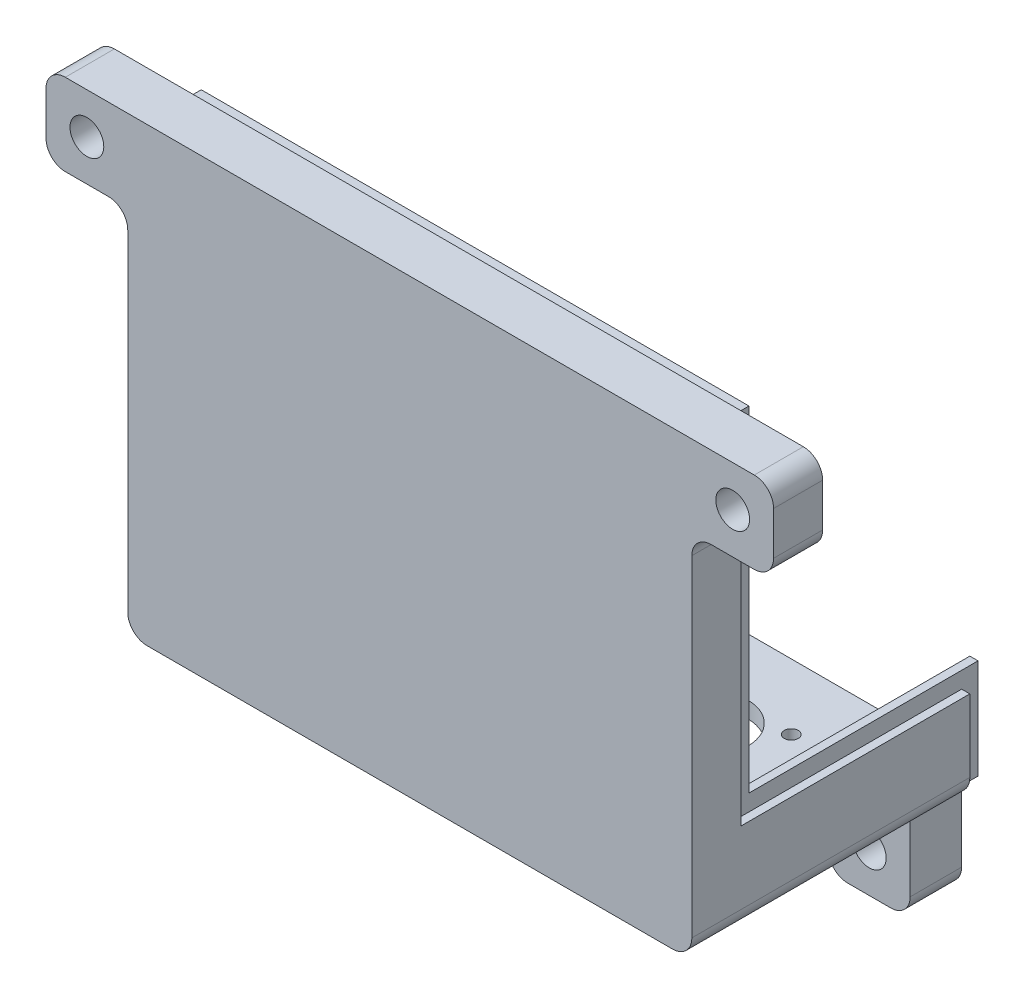
from build123d import *

# Parameters (mm, degrees)
SKETCH1_W           = 82.539998569
SKETCH1_H           = 65.04
BOSS_EXTRUDE1_DEPTH = 43.18
SHELL1_T            = 2.54
SKETCH2_R           = 1.085
CUT_EXTRUDE1_DEPTH  = 124.952130409
FILLET1_R           = 6.20014
FILLET2_R           = 1
SKETCH6_W           = 35.56
SKETCH6_H           = 50.8
CUT_EXTRUDE2_DEPTH  = 124.028758627
SKETCH3_R           = 2.125
BOSS_EXTRUDE2_DEPTH = 9.39038
CUT_EXTRUDE3_DEPTH  = 2.54
SKETCH8_W           = 1.27
SKETCH8_H           = 33.02
CUT_EXTRUDE4_DEPTH  = 2.54
SKETCH10_W          = 87.619998569
SKETCH10_H          = 10.145268184
BOSS_EXTRUDE3_DEPTH = 2.54
CUT_EXTRUDE5_DEPTH  = 2.54
SKETCH11_W          = 12.7
SKETCH11_H          = 8
BOSS_EXTRUDE4_DEPTH = 12.7
SKETCH12_R          = 2.625
CUT_EXTRUDE6_DEPTH  = 127.362400741
SKETCH13_W          = 7.62
SKETCH13_H          = 12.7
BOSS_EXTRUDE5_DEPTH = 12.7
SKETCH14_R          = 2.625
CUT_EXTRUDE7_DEPTH  = 125.717897357
FILLET3_R           = 3


with BuildPart() as part:
    # Sketch1 → Boss-Extrude1 (new body)
    with BuildSketch(Plane.XY):
        with Locations((47.599999189, 40.75)):
            Rectangle(SKETCH1_W, SKETCH1_H)
    extrude(amount=BOSS_EXTRUDE1_DEPTH)

    # Shell1
    shell1_openings = [part.faces().sort_by_distance(p)[0] for p in [
        (47.599999189, 73.27, 21.59),
        (47.599999189, 40.75, 0),
    ]]
    offset(amount=SHELL1_T, openings=shell1_openings, kind=Kind.INTERSECTION)

    # Sketch2 → Cut-Extrude1 (cut, through all)
    with BuildSketch(Plane(origin=(97.099998474, 5.69, 0), x_dir=(0, 0, -1), z_dir=(0, 1, 0))):
        with Locations(Location((-10.166, 73.199999285, 0), (0, 0, 90))):
            Circle(SKETCH2_R)
        with Locations(Location((-10.166, 25.799999285, 0), (0, 0, 90))):
            Circle(SKETCH2_R)
        with Locations(Location((-28.266, 24.299999285, 0), (0, 0, 90))):
            Circle(SKETCH2_R)
        with Locations(Location((-28.266, 74.699999285, 0), (0, 0, 90))):
            Circle(SKETCH2_R)
        Polygon((-33.02, 71.391050497), (-8.912, 71.391050497), (-8.912, 55.244166488), (-6.912, 55.244166488), (-6.912, 43.755832082), (-8.912, 43.755832082), (-8.912, 27.608948073), (-33.02, 27.608948073), align=None)
    extrude(amount=CUT_EXTRUDE1_DEPTH, mode=Mode.SUBTRACT)

    # Fillet1
    fillet1_edges = [part.edges().sort_by_distance(p)[0] for p in [
        (25.708947978, 6.96, 33.02),
        (69.491050401, 6.96, 33.02),
        (69.491050401, 6.96, 8.912),
        (25.708947978, 6.96, 8.912),
    ]]
    fillet(fillet1_edges, radius=FILLET1_R)

    # Fillet2
    fillet2_edges = [part.edges().sort_by_distance(p)[0] for p in [
        (53.344166393, 6.96, 6.912),
        (41.855831986, 6.96, 6.912),
    ]]
    fillet(fillet2_edges, radius=FILLET2_R)
    fillet2_2_edges = [part.edges().sort_by_distance(p)[0] for p in [
        (53.344166393, 6.96, 8.912),
        (41.855831986, 6.96, 8.912),
    ]]
    fillet(fillet2_2_edges, radius=FILLET2_R - 0.0001)  # a hair under: the kernel refuses the full size

    # Sketch6 → Cut-Extrude2 (cut, through all)
    with BuildSketch(Plane.ZY.offset(-3.789999905)):
        with Locations((17.78, 47.87)):
            Rectangle(SKETCH6_W, SKETCH6_H)
    extrude(amount=-CUT_EXTRUDE2_DEPTH, mode=Mode.SUBTRACT)

    # Sketch3 → Boss-Extrude2 (add)
    # profile 1 of 4: a face of its own
    with BuildSketch(Plane(origin=(0, 0, 43.18), x_dir=(-1, 0, 0), z_dir=(0, 0, -1))):
        with BuildLine():
            Line((-86.514394884, 72), (-78.685601874, 72))
            ThreePointArc((-78.685601874, 72), (-78.109870373, 62.509871885), (-87.599998474, 63.085603617))
            Line((-87.599998474, 63.085603617), (-87.599998474, 70.914396383))
            ThreePointArc((-87.599998474, 70.914396383), (-87.090126494, 71.490128006), (-86.514394884, 72))
        make_face()
        with Locations(Location((-82.599998379, 67, 0), (0, 0, 180))):
            Circle(SKETCH3_R, mode=Mode.SUBTRACT)
    # profile 2 of 4: a face of its own
    with BuildSketch(Plane(origin=(0, 0, 43.18), x_dir=(-1, 0, 0), z_dir=(0, 0, -1))):
        with BuildLine():
            Line((-7.599999905, 70.914398454), (-7.599999905, 63.085601546))
            ThreePointArc((-7.599999905, 63.085601546), (-17.090127314, 62.509872815), (-16.514394884, 72))
            Line((-16.514394884, 72), (-8.685601874, 72))
            ThreePointArc((-8.685601874, 72), (-8.109871193, 71.490128936), (-7.599999905, 70.914398454))
        make_face()
        with Locations(Location((-12.599998379, 67, 0), (0, 0, 180))):
            Circle(SKETCH3_R, mode=Mode.SUBTRACT)
    # profile 3 of 4: a face of its own
    with BuildSketch(Plane(origin=(0, 0, 43.18), x_dir=(-1, 0, 0), z_dir=(0, 0, -1))):
        with BuildLine():
            Line((-7.599999905, 20.914398454), (-7.599999905, 13.085601546))
            ThreePointArc((-7.599999905, 13.085601546), (-18.949998379, 17), (-7.599999905, 20.914398454))
        make_face()
        with Locations(Location((-12.599998379, 17, 0), (0, 0, 180))):
            Circle(SKETCH3_R, mode=Mode.SUBTRACT)
    # profile 4 of 4: a face of its own
    with BuildSketch(Plane(origin=(0, 0, 43.18), x_dir=(-1, 0, 0), z_dir=(0, 0, -1))):
        with BuildLine():
            Line((-87.599998474, 20.914396383), (-87.599998474, 13.085603617))
            ThreePointArc((-87.599998474, 13.085603617), (-76.249998379, 17), (-87.599998474, 20.914396383))
        make_face()
        with Locations(Location((-82.599998379, 17, 0), (0, 0, 180))):
            Circle(SKETCH3_R, mode=Mode.SUBTRACT)
    extrude(amount=BOSS_EXTRUDE2_DEPTH)

    # Sketch7 → Cut-Extrude3 (cut)
    with BuildSketch(Plane(origin=(0, 0, 0), x_dir=(-1, 0, 0), z_dir=(0, 0, -1))):
        Polygon((-91.409998474, 22.47), (-90.139998474, 22.47), (-90.139998474, 6.96), (-5.059999905, 6.96), (-5.059999905, 22.47), (-3.789999905, 22.47), (-3.789999905, 5.69), (-91.409998474, 5.69), align=None)
    extrude(amount=-CUT_EXTRUDE3_DEPTH, mode=Mode.SUBTRACT)

    # Sketch8 → Cut-Extrude4 (cut)
    with BuildSketch(Plane(origin=(0, 22.47, 0), x_dir=(1, 0, 0), z_dir=(0, 1, 0))):
        with Locations((4.424999905, -19.05)):
            Rectangle(SKETCH8_W, SKETCH8_H)
        with Locations((90.774998474, -19.05)):
            Rectangle(SKETCH8_W, SKETCH8_H)
    extrude(amount=-CUT_EXTRUDE4_DEPTH, mode=Mode.SUBTRACT)

    # Sketch10 → Boss-Extrude3 (add)
    with BuildSketch(Plane(origin=(0, 73.27, 0), x_dir=(1, 0, 0), z_dir=(0, 1, 0))):
        with Locations((47.59999919, -40.647365908)):
            Rectangle(SKETCH10_W, SKETCH10_H)
    extrude(amount=BOSS_EXTRUDE3_DEPTH)

    # Sketch9 → Cut-Extrude5 (cut)
    with BuildSketch(Plane(origin=(0, 0, 35.56), x_dir=(-1, 0, 0), z_dir=(0, 0, -1))):
        Polygon((-90.139998474, 73.27), (-90.139998474, 74.54), (-5.059999905, 74.54), (-5.059999905, 73.27), (-5.059999905, 19.93), (-3.789999905, 19.93), (-3.789999905, 73.27), (-3.789999905, 75.81), (-91.409998474, 75.81), (-91.409998474, 73.27), (-91.409998474, 19.93), (-90.139998474, 19.93), align=None)
    extrude(amount=-CUT_EXTRUDE5_DEPTH, mode=Mode.SUBTRACT)

    # Sketch11 → Boss-Extrude4 (add)
    with BuildSketch(Plane.XZ.offset(-5.69)):
        with Locations((83.789998474, 6.54)):
            Rectangle(SKETCH11_W, SKETCH11_H)
        with Locations((11.409999905, 6.54)):
            Rectangle(SKETCH11_W, SKETCH11_H)
    extrude(amount=BOSS_EXTRUDE4_DEPTH)

    # Sketch12 → Cut-Extrude6 (cut, through all)
    with BuildSketch(Plane(origin=(0, 0, 2.54), x_dir=(-1, 0, 0), z_dir=(0, 0, -1))):
        with Locations((-83.789998474, -0.66)):
            Circle(SKETCH12_R)
        with Locations((-11.409999905, -0.66)):
            Circle(SKETCH12_R)
    extrude(amount=-CUT_EXTRUDE6_DEPTH, mode=Mode.SUBTRACT)

    # Sketch13 → Boss-Extrude5 (add)
    with BuildSketch(Plane.ZY.offset(-3.789999905)):
        with Locations((41.91, 69.46)):
            Rectangle(SKETCH13_W, SKETCH13_H)
    boss_extrude5 = extrude(amount=BOSS_EXTRUDE5_DEPTH)

    # Sketch14 → Cut-Extrude7 (cut, through all)
    with BuildSketch(Plane(origin=(0, 0, 38.1), x_dir=(-1, 0, 0), z_dir=(0, 0, -1))):
        with Locations(Location((2.560000095, 69.46, 0), (0, 0, 90))):
            Circle(SKETCH14_R)
    cut_extrude7 = extrude(amount=-CUT_EXTRUDE7_DEPTH, mode=Mode.SUBTRACT)

    # Mirror1: Boss-Extrude5, Cut-Extrude7 across plane
    add(boss_extrude5.mirror(Plane.ZY.offset(-47.599999189)))
    add(cut_extrude7.mirror(Plane.ZY.offset(-47.599999189)), mode=Mode.SUBTRACT)

    # Fillet3
    fillet3_edges = [part.edges().sort_by_distance(p)[0] for p in [
        (6.329999905, 73.27, 39.377365908),
        (6.329999905, 8.23, 21.59),
        (88.869998474, 8.23, 21.59),
        (88.869998474, 73.27, 39.377365908),
        (17.759999905, 5.69, 6.54),
        (17.759999905, -7.01, 6.54),
        (5.059999905, -7.01, 6.54),
        (77.439998474, 5.69, 6.54),
        (90.139998474, -7.01, 6.54),
        (77.439998474, -7.01, 6.54),
        (3.789999905, 63.11, 41.91),
        (-8.910000095, 63.11, 41.91),
        (-8.910000095, 75.81, 41.91),
        (104.109998474, 75.81, 41.91),
        (104.109998474, 63.11, 41.91),
        (91.409998474, 63.11, 41.91),
        (91.409998474, 5.69, 24.13),
        (3.789999905, 5.69, 24.13),
    ]]
    fillet(fillet3_edges, radius=FILLET3_R)


solid = part.part
